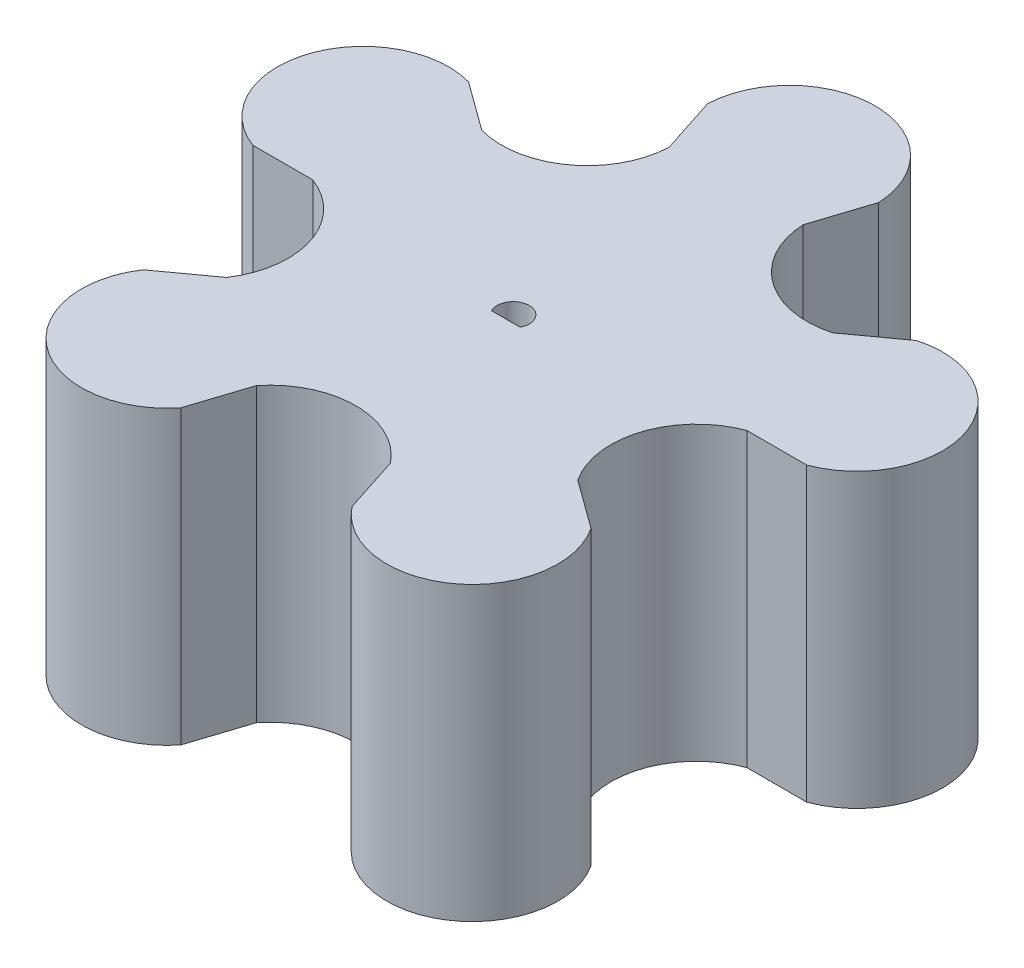
from build123d import *

# Parameters (mm, degrees)
BOSS_EXTRUDE1_DEPTH = 19.05
CUT_EXTRUDE1_DEPTH  = 49.906299697


with BuildPart() as part:
    # Sketch2 → Boss-Extrude1 (new body)
    with BuildSketch(Plane(origin=(0, 0, 0), x_dir=(1, 0, 0), z_dir=(0, 1, 0))):
        with BuildLine():
            ThreePointArc((5.582827527, 34.123976372), (0, 39.4716), (-5.582827527, 34.123976372))
            Line((-5.582827527, 34.123976372), (-4.37531266, 30.407627744))
            ThreePointArc((-4.37531266, 30.407627744), (-6.673596197, 26.127217151), (-11.454717255, 25.264139232))
            Line((-11.454717255, 25.264139232), (-14.61603222, 27.560968998))
            ThreePointArc((-14.61603222, 27.560968998), (-21.427113101, 23.90389108), (-18.066409385, 16.9418))
            Line((-18.066409385, 16.9418), (-14.15880919, 16.9418))
            ThreePointArc((-14.15880919, 16.9418), (-10.798105475, 13.433282849), (-11.454717255, 8.619460768))
            Line((-11.454717255, 8.619460768), (-14.61603222, 6.322631002))
            ThreePointArc((-14.61603222, 6.322631002), (-13.242684177, -1.28519108), (-5.582827527, -0.240376372))
            Line((-5.582827527, -0.240376372), (-4.37531266, 3.475972256))
            ThreePointArc((-4.37531266, 3.475972256), (0, 5.588), (4.37531266, 3.475972256))
            Line((4.37531266, 3.475972256), (5.582827527, -0.240376372))
            ThreePointArc((5.582827527, -0.240376372), (13.242684177, -1.28519108), (14.61603222, 6.322631002))
            Line((14.61603222, 6.322631002), (11.454717255, 8.619460768))
            ThreePointArc((11.454717255, 8.619460768), (10.798105475, 13.433282849), (14.15880919, 16.9418))
            Line((14.15880919, 16.9418), (18.066409385, 16.9418))
            ThreePointArc((18.066409385, 16.9418), (21.427113101, 23.90389108), (14.61603222, 27.560968998))
            Line((14.61603222, 27.560968998), (11.454717255, 25.264139232))
            ThreePointArc((11.454717255, 25.264139232), (6.673596197, 26.127217151), (4.37531266, 30.407627744))
            Line((4.37531266, 30.407627744), (5.582827527, 34.123976372))
        make_face()
    extrude(amount=BOSS_EXTRUDE1_DEPTH)

    # Sketch3 → Cut-Extrude1 (cut, through all)
    with BuildSketch(Plane(origin=(0, 19.05, 0), x_dir=(1, 0, 0), z_dir=(0, 1, 0))):
        with BuildLine():
            Line((-0.933255592, 15.381358575), (0.933255592, 15.381358575))
            ThreePointArc((0.933255592, 15.381358575), (0, 16.905358575), (-0.933255592, 15.381358575))
        make_face()
    extrude(amount=-CUT_EXTRUDE1_DEPTH, mode=Mode.SUBTRACT)


solid = part.part
